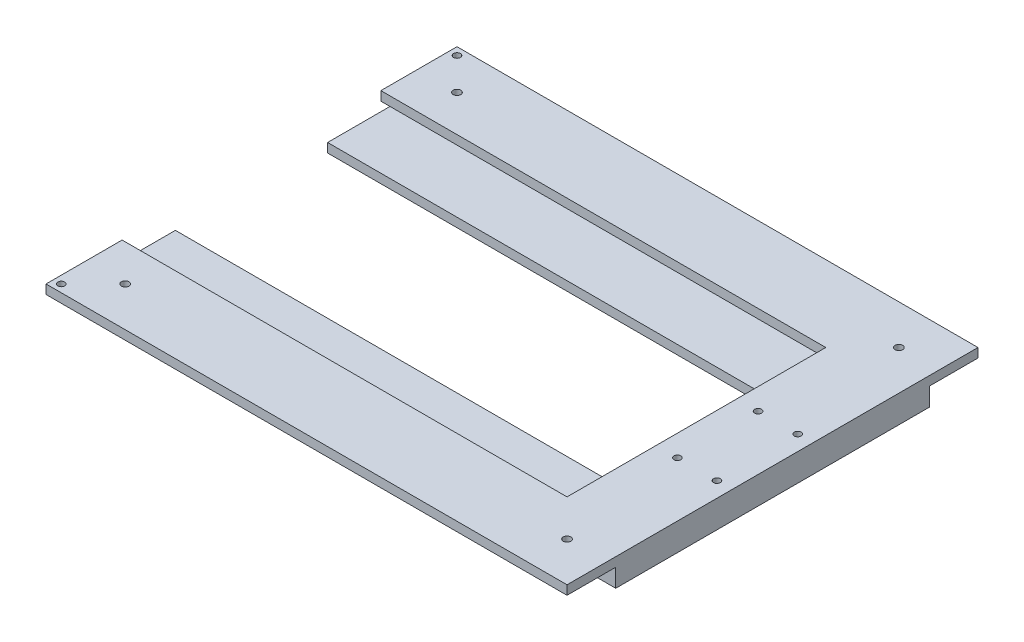
from build123d import *

# Parameters (mm, degrees)
EXTRUDE_2_DEPTH             = 6
EXTRUDE_3_DEPTH             = 6
SKETCH_4_R                  = 2.5
CUT_EXTRUDE_1_DEPTH         = 455.56865906
PATTERN_LINEAR_2_COUNT      = 2
PATTERN_LINEAR_2_PITCH      = 290.3
PATTERN_LINEAR_2_COUNT_DIR2 = 2
PATTERN_LINEAR_2_PITCH_DIR2 = 218
EXTRUDE_4_DEPTH             = 6
SKETCH_6_R                  = 2.25
CUT_EXTRUDE_2_DEPTH         = 455.766605854
SKETCH_7_R                  = 2.25
CUT_EXTRUDE_3_DEPTH         = 455.56865906


with BuildPart() as part:
    # Эскиз1 → Бобышка-Вытянуть2 (new body)
    with BuildSketch(Plane(origin=(0, 0, 0), x_dir=(1, 0, 0), z_dir=(0, 1, 0))):
        Polygon((50, -77.921508101), (50, -347.921508101), (-292.3, -347.921508101), (-292.3, -297.921508101), (0, -297.921508101), (0, -127.921508101), (-292.3, -127.921508101), (-292.3, -77.921508101), align=None)
    extrude(amount=EXTRUDE_2_DEPTH)

    # Эскиз2 → Бобышка-Вытянуть3 (add)
    with BuildSketch(Plane.XZ):
        Polygon((50, 315.921508101), (50, 109.921508101), (-292.3, 109.921508101), (-292.3, 121.921508101), (6, 121.921508101), (6, 303.921508101), (-292.3, 303.921508101), (-292.3, 315.921508101), align=None)
    extrude(amount=EXTRUDE_3_DEPTH)

    # Эскиз4 → Вырез-Вытянуть1 (cut, through all)
    with BuildSketch(Plane(origin=(0, 6, 0), x_dir=(1, 0, 0), z_dir=(0, 1, 0))):
        with Locations((-266.3, -103.921508101)):
            Circle(SKETCH_4_R)
    cut_extrude_1 = extrude(amount=-CUT_EXTRUDE_1_DEPTH, mode=Mode.SUBTRACT)

    # Линейный массив2: Cut-Extrude 1 2 × 2
    with Locations(*[(i * PATTERN_LINEAR_2_PITCH, 0, j * PATTERN_LINEAR_2_PITCH_DIR2) for i in range(PATTERN_LINEAR_2_COUNT) for j in range(PATTERN_LINEAR_2_COUNT_DIR2) if (i, j) != (0, 0)]):
        add(cut_extrude_1, mode=Mode.SUBTRACT)

    # Эскиз5 → Бобышка-Вытянуть4 (add)
    with BuildSketch(Plane.XZ.offset(6)):
        Polygon((50, 315.921508101), (-292.3, 315.921508101), (-292.3, 262.921508101), (0, 262.921508101), (0, 162.921508101), (-292.3, 162.921508101), (-292.3, 109.921508101), (50, 109.921508101), align=None)
    extrude(amount=EXTRUDE_4_DEPTH)

    # Эскиз6 → Вырез-Вытянуть2 (cut, through all)
    with BuildSketch(Plane.XZ.offset(12)):
        with Locations((14, 239.421508101)):
            Circle(SKETCH_6_R)
        with Locations((40, 239.421508101)):
            Circle(SKETCH_6_R)
        with Locations((40, 186.421508101)):
            Circle(SKETCH_6_R)
        with Locations((14, 186.421508101)):
            Circle(SKETCH_6_R)
    extrude(amount=-CUT_EXTRUDE_2_DEPTH, mode=Mode.SUBTRACT)

    # Эскиз7 → Вырез-Вытянуть3 (cut, through all)
    with BuildSketch(Plane.XZ):
        with Locations((-287.3, 342.921508101)):
            Circle(SKETCH_7_R)
        with Locations((-287.3, 82.921508101)):
            Circle(SKETCH_7_R)
    extrude(amount=-CUT_EXTRUDE_3_DEPTH, mode=Mode.SUBTRACT)


solid = part.part
